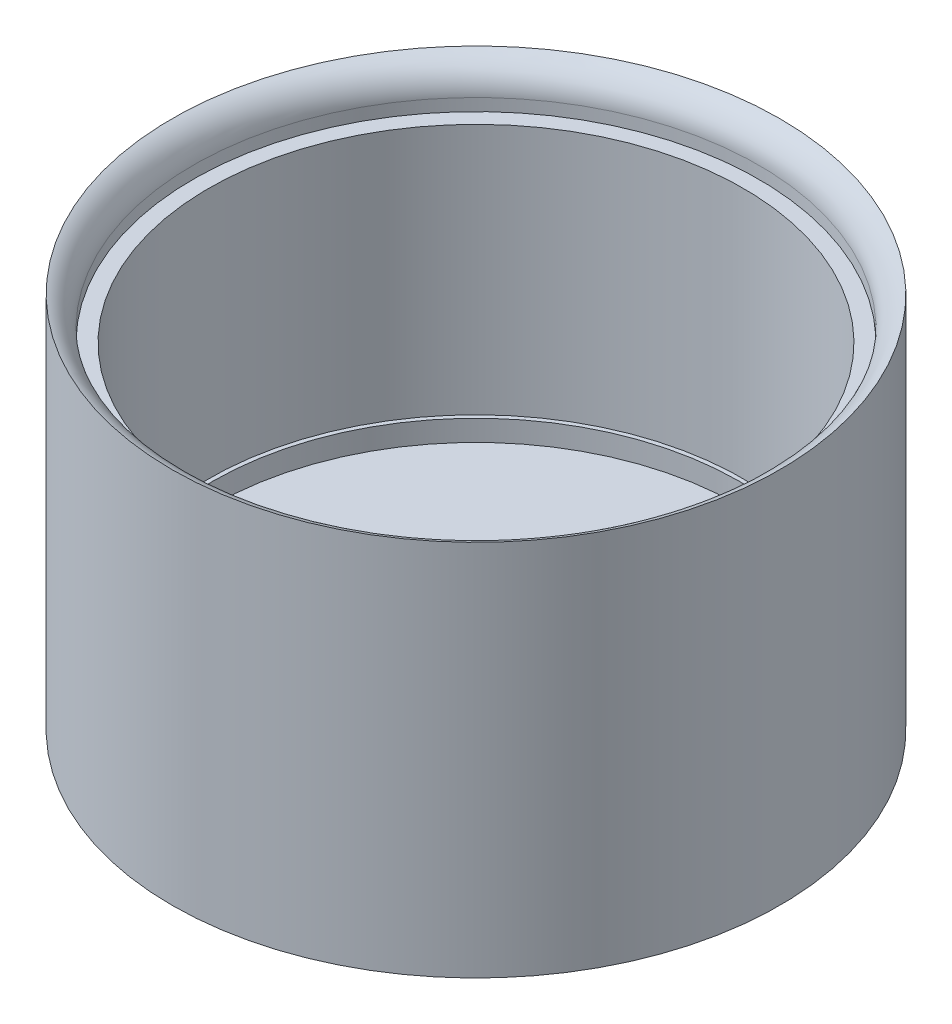
from build123d import *

# Parameters (mm, degrees)
SKETCH1_R           = 29
SKETCH1_R_2         = 25.5
BOSS_EXTRUDE1_DEPTH = 30
CUT_EXTRUDE1_START  = -4
SKETCH2_R           = 26.983908251
SKETCH2_R_2         = 25.5
CUT_EXTRUDE1_DEPTH  = 4
BOSS_EXTRUDE2_START = 6
SKETCH3_R           = 29
BOSS_EXTRUDE2_DEPTH = 6
SKETCH4_R           = 4
CUT_EXTRUDE2_DEPTH  = 4.3
SKETCH5_R           = 25.5
SKETCH5_R_2         = 25.1
BOSS_EXTRUDE3_DEPTH = 2


with BuildPart() as part:
    # Sketch1 → Boss-Extrude1 (new body)
    with BuildSketch(Plane(origin=(0, 0, 0), x_dir=(1, 0, 0), z_dir=(0, 1, 0))):
        with Locations(Location((0, 0, 0), (0, 0, 270))):
            Circle(SKETCH1_R)
        with Locations(Location((0, 0, 0), (0, 0, 270))):
            Circle(SKETCH1_R_2, mode=Mode.SUBTRACT)
    extrude(amount=BOSS_EXTRUDE1_DEPTH)

    # Sketch2 → Cut-Extrude1 (cut)
    with BuildSketch(Plane(origin=(0, 30, 0), x_dir=(1, 0, 0), z_dir=(0, 1, 0)).offset(CUT_EXTRUDE1_START)):
        with Locations(Location((0, 0, 0), (0, 0, 270))):
            Circle(SKETCH2_R)
        with Locations(Location((0, 0, 0), (0, 0, 270))):
            Circle(SKETCH2_R_2, mode=Mode.SUBTRACT)
    extrude(amount=CUT_EXTRUDE1_DEPTH, mode=Mode.SUBTRACT)

    # Fillet1: read off the stored shape, not the designer's step
    # Fillet1 outline → Fillet1 (revolve, cut)
    with BuildSketch(Plane.XY):
        with BuildLine():
            ThreePointArc((26.983908251, 27.165934977), (27.539350545, 28.904939757), (29, 30))
            Line((29, 30), (26.983908251, 30))
            Line((26.983908251, 30), (26.983908251, 27.165934977))
        make_face()
    revolve(axis=Axis((0, 0, 0), (0, 1, 0)), mode=Mode.SUBTRACT)

    # Sketch3 → Boss-Extrude2 (add)
    with BuildSketch(Plane.XZ.offset(BOSS_EXTRUDE2_START)):
        with Locations(Location((0, 0, 0), (0, 0, 270))):
            Circle(SKETCH3_R)
    extrude(amount=-BOSS_EXTRUDE2_DEPTH)

    # Sketch4 → Cut-Extrude2 (cut)
    with BuildSketch(Plane(origin=(0, 0, 0), x_dir=(1, 0, 0), z_dir=(0, 1, 0))):
        with Locations(Location((0, 0, 0), (0, 0, 270))):
            Circle(SKETCH4_R)
    extrude(amount=-CUT_EXTRUDE2_DEPTH, mode=Mode.SUBTRACT)

    # Sketch5 → Boss-Extrude3 (add)
    with BuildSketch(Plane(origin=(0, 0, 0), x_dir=(1, 0, 0), z_dir=(0, 1, 0))):
        with Locations(Location((0, 0, 0), (0, 0, 270))):
            Circle(SKETCH5_R)
        with Locations(Location((0, 0, 0), (0, 0, 270))):
            Circle(SKETCH5_R_2, mode=Mode.SUBTRACT)
    extrude(amount=BOSS_EXTRUDE3_DEPTH)


solid = part.part
